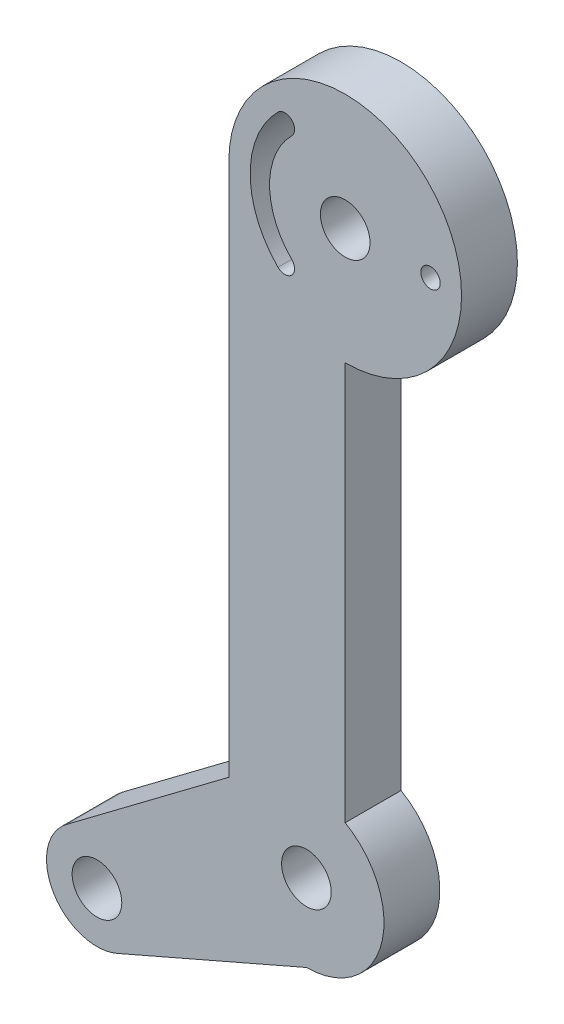
from build123d import *

# Parameters (mm, degrees)
SKETCH1_R           = 1.6
BOSS_EXTRUDE1_DEPTH = 3.6
SKETCH2_R           = 0.625
CUT_EXTRUDE1_DEPTH  = 49.15103841


with BuildPart() as part:
    # Sketch1 → Boss-Extrude1 (new body)
    with BuildSketch(Plane.XY):
        with BuildLine():
            Line((-5, 37.5), (-5, 3.117408991))
            Line((-5, 3.117408991), (-15.45246273, -4.737424277))
            ThreePointArc((-15.45246273, -4.737424277), (-16.30801025, -8.97190619), (-12.202106424, -10.31516804))
            Line((-12.202106424, -10.31516804), (0, -5))
            ThreePointArc((0, -5), (4.829629131, -1.294095226), (2.5, 4.330127019))
            Line((2.5, 4.330127019), (2.5, 30))
            ThreePointArc((2.5, 30), (7.803300859, 42.803300859), (-5, 37.5))
        make_face()
        Circle(SKETCH1_R, mode=Mode.SUBTRACT)
        with Locations((-13.5, -7.335575406)):
            Circle(SKETCH1_R, mode=Mode.SUBTRACT)
        with Locations((2.5, 37.5)):
            Circle(SKETCH1_R, mode=Mode.SUBTRACT)
    extrude(amount=BOSS_EXTRUDE1_DEPTH)

    # Sketch2 → Cut-Extrude1 (cut, through all)
    with BuildSketch(Plane.XY.offset(3.6)):
        with Locations((8, 37.5)):
            Circle(SKETCH2_R)
        with BuildLine():
            ThreePointArc((-0.947145558, 40.947145558), (-0.947145558, 41.831029035), (-1.831029035, 41.831029035))
            ThreePointArc((-1.831029035, 41.831029035), (-3.625, 37.5), (-1.831029035, 33.168970965))
            ThreePointArc((-1.831029035, 33.168970965), (-0.947145558, 33.168970965), (-0.947145558, 34.052854442))
            ThreePointArc((-0.947145558, 34.052854442), (-2.375, 37.5), (-0.947145558, 40.947145558))
        make_face()
    extrude(amount=-CUT_EXTRUDE1_DEPTH, mode=Mode.SUBTRACT)


solid = part.part
